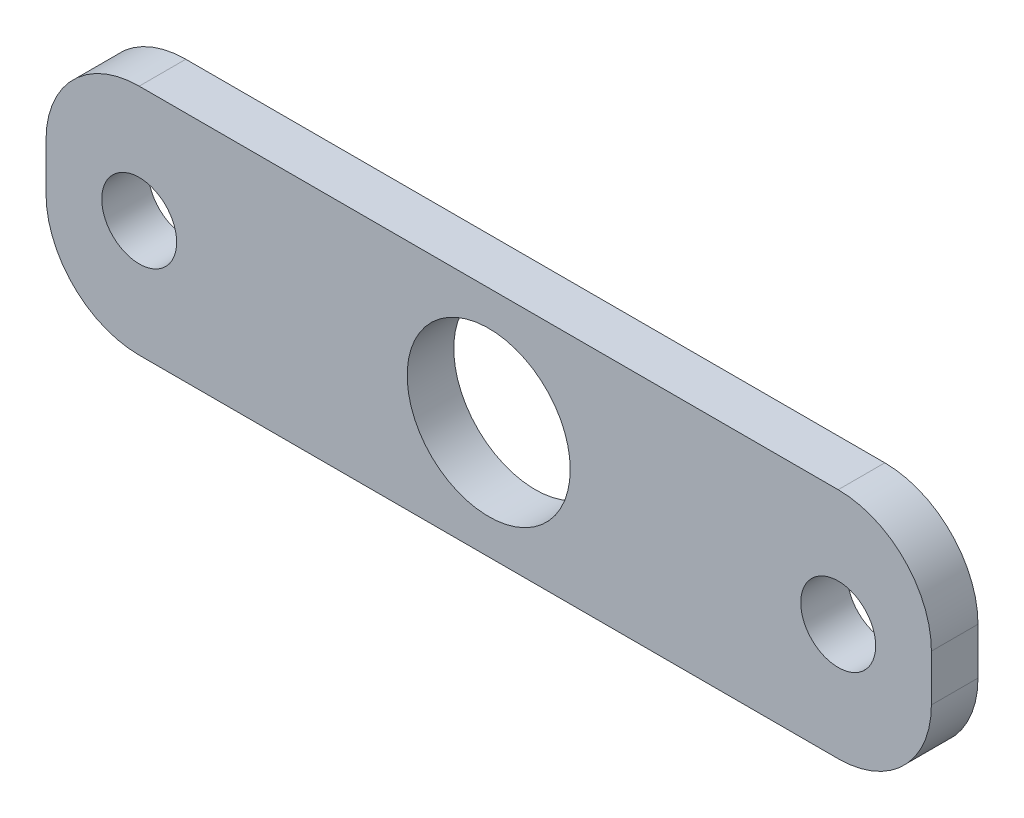
from build123d import *

# Parameters (mm, degrees)
SKETCH1_W           = 60.325
SKETCH1_H           = 15.875
SKETCH1_R           = 5.55625
SKETCH1_R_2         = 2.5527
BOSS_EXTRUDE1_DEPTH = 1.5875
FILLET3_R           = 6.35


with BuildPart() as part:
    # Sketch1 → Boss-Extrude1 (new, symmetric)
    with BuildSketch(Plane.XY):
        Rectangle(SKETCH1_W, SKETCH1_H)
        Circle(SKETCH1_R, mode=Mode.SUBTRACT)
        with Locations((-23.8125, 0)):
            Circle(SKETCH1_R_2, mode=Mode.SUBTRACT)
        with Locations((23.8125, 0)):
            Circle(SKETCH1_R_2, mode=Mode.SUBTRACT)
    extrude(amount=BOSS_EXTRUDE1_DEPTH, both=True)

    # Fillet3
    fillet3_edges = [part.edges().sort_by_distance(p)[0] for p in [
        (30.1625, -7.9375, 0),
        (-30.1625, -7.9375, 0),
        (30.1625, 7.9375, 0),
        (-30.1625, 7.9375, 0),
    ]]
    fillet(fillet3_edges, radius=FILLET3_R)


solid = part.part
